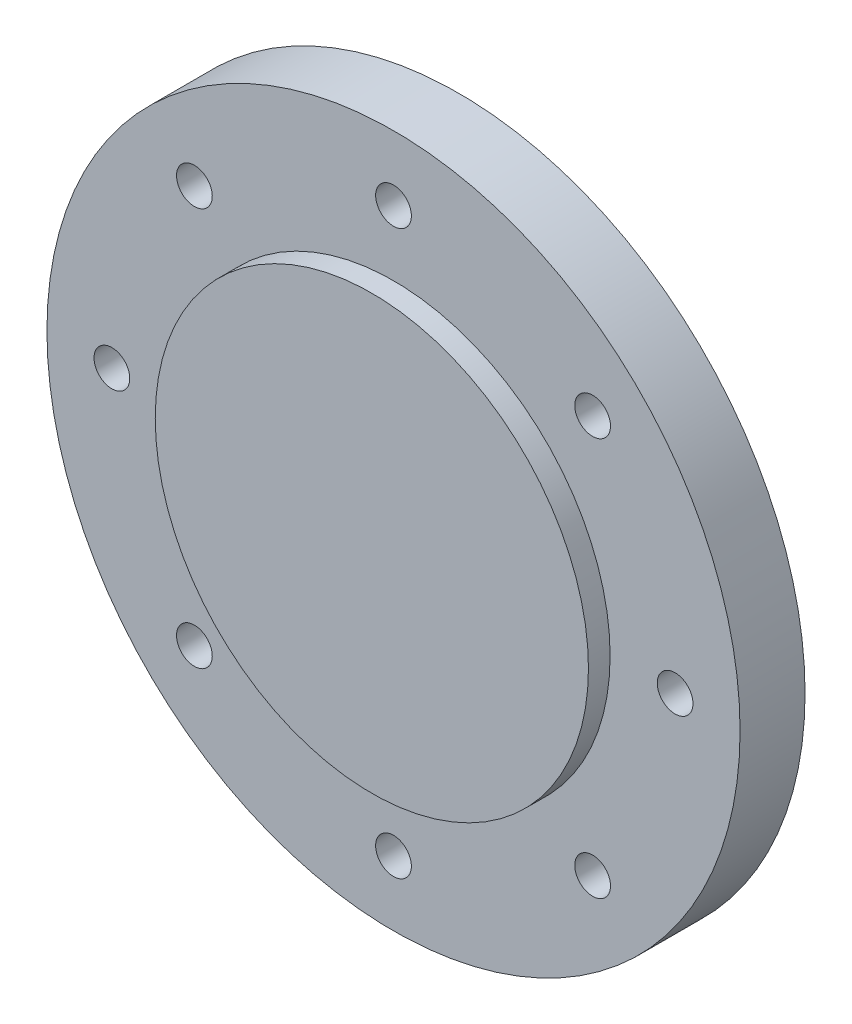
from build123d import *

# Parameters (mm, degrees)
SK_DISC_R                 = 32
OUTPUT_DISC_DEPTH         = 6
SK_PILOT_R                = 20
PILOT_BOSS_DEPTH          = 2
SK_OUTHOLE_R              = 1.65
OUTPUT_TAPPED_HOLE_DEPTH  = 6
OUTPUT_HOLE_PATTERN_COUNT = 8


with BuildPart() as part:
    # SK_Disc → Output_Disc (new body)
    with BuildSketch(Plane.XY):
        Circle(SK_DISC_R)
    extrude(amount=OUTPUT_DISC_DEPTH)

    # SK_Pilot → Pilot_Boss (add)
    with BuildSketch(Plane.XY.offset(6)):
        Circle(SK_PILOT_R)
    extrude(amount=PILOT_BOSS_DEPTH)

    # SK_OutHole → Output_Tapped_Hole (cut)
    with BuildSketch(Plane.XY.offset(6)):
        with Locations((26, 0)):
            Circle(SK_OUTHOLE_R)
    output_tapped_hole = extrude(amount=-OUTPUT_TAPPED_HOLE_DEPTH, mode=Mode.SUBTRACT)

    # Output_Hole_Pattern: Output_Tapped_Hole ×8 about axis
    output_hole_pattern_axis = Axis((0, 0, -0.4), (0, 0, 1))
    for i in range(1, OUTPUT_HOLE_PATTERN_COUNT):
        add(output_tapped_hole.rotate(output_hole_pattern_axis, i * 360 / OUTPUT_HOLE_PATTERN_COUNT), mode=Mode.SUBTRACT)


solid = part.part
